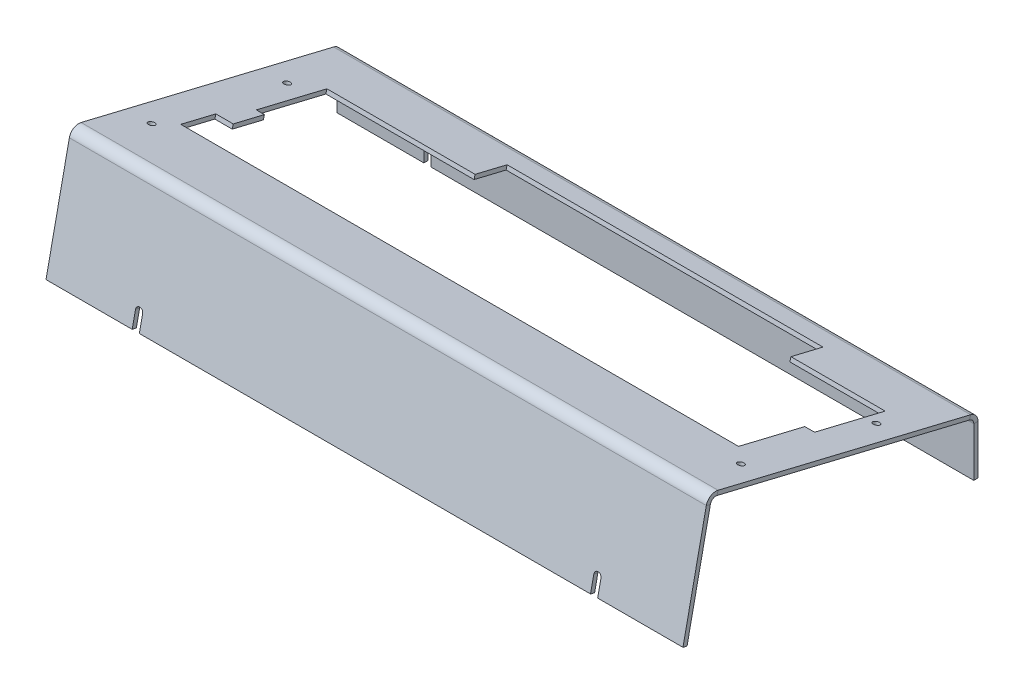
from build123d import *

# Parameters (mm, degrees)
BASE_FLANGE1_DEPTH = 348
CUT_EXTRUDE1_REACH = 391.047
SKETCH6_R          = 1.95
CUT_EXTRUDE2_REACH = 384.238
SKETCH7_R          = 1.95
CUT_EXTRUDE3_REACH = 389.236
CUT_EXTRUDE4_REACH = 389.217
SKETCH9_R          = 1.75


# Sheet-metal steps are written as plain solids
with BuildPart() as part:
    # Sketch1 → Base-Flange1 (new body)
    with BuildSketch(Plane(origin=(0, 0, 0), x_dir=(0, 0, -1), z_dir=(1, 0, 0))):
        with BuildLine():
            Line((-156.66, 0), (-143.903368262, 60.704710735))
            ThreePointArc((-143.903368262, 60.704710735), (-142.570157767, 62.623791445), (-140.264606132, 63.004255181))
            Line((-140.264606132, 63.004255181), (-2.297114265, 29.753612482))
            ThreePointArc((-2.297114265, 29.753612482), (-0.643237686, 28.693367991), (0, 26.837116015))
            Line((0, 26.837116015), (0, 0))
            Line((0, 0), (2.286, 0))
            Line((2.286, 0), (2.286, 26.837116015))
            ThreePointArc((2.286, 26.837116015), (1.152615197, 30.107831996), (-1.761515334, 31.97598279))
            Line((-1.761515334, 31.97598279), (-139.729007202, 65.226625489))
            ThreePointArc((-139.729007202, 65.226625489), (-143.791389182, 64.556248387), (-146.140506074, 61.174828176))
            Line((-146.140506074, 61.174828176), (-158.897137813, 0.47011744))
            Line((-158.897137813, 0.47011744), (-156.66, 0))
        make_face()
    extrude(amount=BASE_FLANGE1_DEPTH)

    # Sketch6 → Cut-Extrude1 (cut, up to next)
    with BuildSketch(Plane(origin=(0, 0, -2.286), x_dir=(-1, 0, 0), z_dir=(0, 0, -1)), mode=Mode.PRIVATE) as cut_extrude1_sk1:
        with BuildLine():
            Line((-51.45, 7.64), (-51.45, 0))
            Line((-51.45, 0), (-47.55, 0))
            Line((-47.55, 0), (-47.55, 7.64))
            ThreePointArc((-47.55, 7.64), (-49.5, 5.69), (-51.45, 7.64))
        make_face()
    cut_extrude1_tool1 = extrude(cut_extrude1_sk1.sketch, amount=-CUT_EXTRUDE1_REACH, mode=Mode.PRIVATE) & part.part
    # Sketch6 → Cut-Extrude1 (cut, up to next)
    with BuildSketch(Plane(origin=(0, 0, -2.286), x_dir=(-1, 0, 0), z_dir=(0, 0, -1)), mode=Mode.PRIVATE) as cut_extrude1_sk2:
        with Locations((-49.5, 7.64)):
            Circle(SKETCH6_R)
    cut_extrude1_tool2 = extrude(cut_extrude1_sk2.sketch, amount=-CUT_EXTRUDE1_REACH, mode=Mode.PRIVATE) & part.part
    # Sketch6 → Cut-Extrude1 (cut, up to next)
    with BuildSketch(Plane(origin=(0, 0, -2.286), x_dir=(-1, 0, 0), z_dir=(0, 0, -1)), mode=Mode.PRIVATE) as cut_extrude1_sk3:
        with BuildLine():
            ThreePointArc((-298.13, 7.64), (-300.08, 5.69), (-302.03, 7.64))
            Line((-302.03, 7.64), (-302.03, 0))
            Line((-302.03, 0), (-298.13, 0))
            Line((-298.13, 0), (-298.13, 7.64))
        make_face()
    cut_extrude1_tool3 = extrude(cut_extrude1_sk3.sketch, amount=-CUT_EXTRUDE1_REACH, mode=Mode.PRIVATE) & part.part
    # Sketch6 → Cut-Extrude1 (cut, up to next)
    with BuildSketch(Plane(origin=(0, 0, -2.286), x_dir=(-1, 0, 0), z_dir=(0, 0, -1)), mode=Mode.PRIVATE) as cut_extrude1_sk4:
        with Locations((-300.08, 7.64)):
            Circle(SKETCH6_R)
    cut_extrude1_tool4 = extrude(cut_extrude1_sk4.sketch, amount=-CUT_EXTRUDE1_REACH, mode=Mode.PRIVATE) & part.part
    add(cut_extrude1_tool1.solids().sort_by_distance((49.5, 3.069742, -2.286))[0], mode=Mode.SUBTRACT)
    add(cut_extrude1_tool2.solids().sort_by_distance((49.5, 7.64, -2.286))[0], mode=Mode.SUBTRACT)
    add(cut_extrude1_tool3.solids().sort_by_distance((300.08, 3.069742, -2.286))[0], mode=Mode.SUBTRACT)
    add(cut_extrude1_tool4.solids().sort_by_distance((300.08, 7.64, -2.286))[0], mode=Mode.SUBTRACT)

    # Sketch7 → Cut-Extrude2 (cut, up to next)
    with BuildSketch(Plane(origin=(0, 31.998723581, 152.271641819), x_dir=(1, 0, 0), z_dir=(0, 0.20565067377814067, 0.9786254648100042)), mode=Mode.PRIVATE) as cut_extrude2_sk1:
        with Locations((299.45, -23.507234554)):
            Circle(SKETCH7_R)
    cut_extrude2_tool1 = extrude(cut_extrude2_sk1.sketch, amount=-CUT_EXTRUDE2_REACH, mode=Mode.PRIVATE) & part.part
    # Sketch7 → Cut-Extrude2 (cut, up to next)
    with BuildSketch(Plane(origin=(0, 31.998723581, 152.271641819), x_dir=(1, 0, 0), z_dir=(0, 0.20565067377814067, 0.9786254648100042)), mode=Mode.PRIVATE) as cut_extrude2_sk2:
        with BuildLine():
            Line((297.5, -23.507234554), (297.5, -32.217234554))
            Line((297.5, -32.217234554), (301.4, -32.217234554))
            Line((301.4, -32.217234554), (301.4, -23.507234554))
            ThreePointArc((301.4, -23.507234554), (299.45, -25.457234554), (297.5, -23.507234554))
        make_face()
    cut_extrude2_tool2 = extrude(cut_extrude2_sk2.sketch, amount=-CUT_EXTRUDE2_REACH, mode=Mode.PRIVATE) & part.part
    # Sketch7 → Cut-Extrude2 (cut, up to next)
    with BuildSketch(Plane(origin=(0, 31.998723581, 152.271641819), x_dir=(1, 0, 0), z_dir=(0, 0.20565067377814067, 0.9786254648100042)), mode=Mode.PRIVATE) as cut_extrude2_sk3:
        with Locations((49.06, -23.507234554)):
            Circle(SKETCH7_R)
    cut_extrude2_tool3 = extrude(cut_extrude2_sk3.sketch, amount=-CUT_EXTRUDE2_REACH, mode=Mode.PRIVATE) & part.part
    # Sketch7 → Cut-Extrude2 (cut, up to next)
    with BuildSketch(Plane(origin=(0, 31.998723581, 152.271641819), x_dir=(1, 0, 0), z_dir=(0, 0.20565067377814067, 0.9786254648100042)), mode=Mode.PRIVATE) as cut_extrude2_sk4:
        with BuildLine():
            ThreePointArc((51.01, -23.507234554), (49.06, -25.457234554), (47.11, -23.507234554))
            Line((47.11, -23.507234554), (47.11, -32.217234554))
            Line((47.11, -32.217234554), (51.01, -32.217234554))
            Line((51.01, -32.217234554), (51.01, -23.507234554))
        make_face()
    cut_extrude2_tool4 = extrude(cut_extrude2_sk4.sketch, amount=-CUT_EXTRUDE2_REACH, mode=Mode.PRIVATE) & part.part
    add(cut_extrude2_tool1.solids().sort_by_distance((299.45, 8.993945, 157.10592))[0], mode=Mode.SUBTRACT)
    add(cut_extrude2_tool2.solids().sort_by_distance((299.45, 3.995548, 158.156295))[0], mode=Mode.SUBTRACT)
    add(cut_extrude2_tool3.solids().sort_by_distance((49.06, 8.993945, 157.10592))[0], mode=Mode.SUBTRACT)
    add(cut_extrude2_tool4.solids().sort_by_distance((49.06, 3.995548, 158.156295))[0], mode=Mode.SUBTRACT)

    # Sketch8 → Cut-Extrude3 (cut, up to next)
    with BuildSketch(Plane(origin=(0, 29.819457861, -7.186592475), x_dir=(1, 0, 0), z_dir=(0, 0.9721654890653966, -0.23429524508670335)), mode=Mode.PRIVATE) as cut_extrude3_sk1:
        Polygon((324.49, -115.414305141), (19.74, -115.414305141), (19.74, -95.714305141), (29.26, -95.714305141), (29.26, -78.184305141), (24.81, -78.184305141), (24.81, -38.504305141), (105.77, -38.504305141), (105.77, -20.504305141), (278.31, -20.504305141), (278.31, -38.504305141), (329.83, -38.504305141), (329.83, -78.184305141), (324.49, -78.184305141), align=None)
    cut_extrude3_tool1 = extrude(cut_extrude3_sk1.sketch, amount=-CUT_EXTRUDE3_REACH, mode=Mode.PRIVATE) & part.part
    add(cut_extrude3_tool1.solids().sort_by_distance((177.78099, 46.525494, 62.132065))[0], mode=Mode.SUBTRACT)

    # Sketch9 → Cut-Extrude4 (cut, up to next)
    with BuildSketch(Plane(origin=(0, 27.597087553, -6.650993545), x_dir=(1, 0, 0), z_dir=(0, -0.9721654890653966, 0.23429524508670332)), mode=Mode.PRIVATE) as cut_extrude4_sk1:
        with Locations(Location((13.84, 125.740713464, 0), (0, 0, 270))):
            Circle(SKETCH9_R)
    cut_extrude4_tool1 = extrude(cut_extrude4_sk1.sketch, amount=-CUT_EXTRUDE4_REACH, mode=Mode.PRIVATE) & part.part
    # Sketch9 → Cut-Extrude4 (cut, up to next)
    with BuildSketch(Plane(origin=(0, 27.597087553, -6.650993545), x_dir=(1, 0, 0), z_dir=(0, -0.9721654890653966, 0.23429524508670332)), mode=Mode.PRIVATE) as cut_extrude4_sk2:
        with Locations(Location((335.82, 125.740713464, 0), (0, 0, 270))):
            Circle(SKETCH9_R)
    cut_extrude4_tool2 = extrude(cut_extrude4_sk2.sketch, amount=-CUT_EXTRUDE4_REACH, mode=Mode.PRIVATE) & part.part
    # Sketch9 → Cut-Extrude4 (cut, up to next)
    with BuildSketch(Plane(origin=(0, 27.597087553, -6.650993545), x_dir=(1, 0, 0), z_dir=(0, -0.9721654890653966, 0.23429524508670332)), mode=Mode.PRIVATE) as cut_extrude4_sk3:
        with Locations(Location((335.82, 49.560713464, 0), (0, 0, 270))):
            Circle(SKETCH9_R)
    cut_extrude4_tool3 = extrude(cut_extrude4_sk3.sketch, amount=-CUT_EXTRUDE4_REACH, mode=Mode.PRIVATE) & part.part
    # Sketch9 → Cut-Extrude4 (cut, up to next)
    with BuildSketch(Plane(origin=(0, 27.597087553, -6.650993545), x_dir=(1, 0, 0), z_dir=(0, -0.9721654890653966, 0.23429524508670332)), mode=Mode.PRIVATE) as cut_extrude4_sk4:
        with Locations(Location((13.84, 49.560713464, 0), (0, 0, 270))):
            Circle(SKETCH9_R)
    cut_extrude4_tool4 = extrude(cut_extrude4_sk4.sketch, amount=-CUT_EXTRUDE4_REACH, mode=Mode.PRIVATE) & part.part
    add(cut_extrude4_tool1.solids().sort_by_distance((13.84, 57.057539, 115.589789))[0], mode=Mode.SUBTRACT)
    add(cut_extrude4_tool2.solids().sort_by_distance((335.82, 57.057539, 115.589789))[0], mode=Mode.SUBTRACT)
    add(cut_extrude4_tool3.solids().sort_by_distance((335.82, 39.208927, 41.530222))[0], mode=Mode.SUBTRACT)
    add(cut_extrude4_tool4.solids().sort_by_distance((13.84, 39.208927, 41.530222))[0], mode=Mode.SUBTRACT)


solid = part.part
